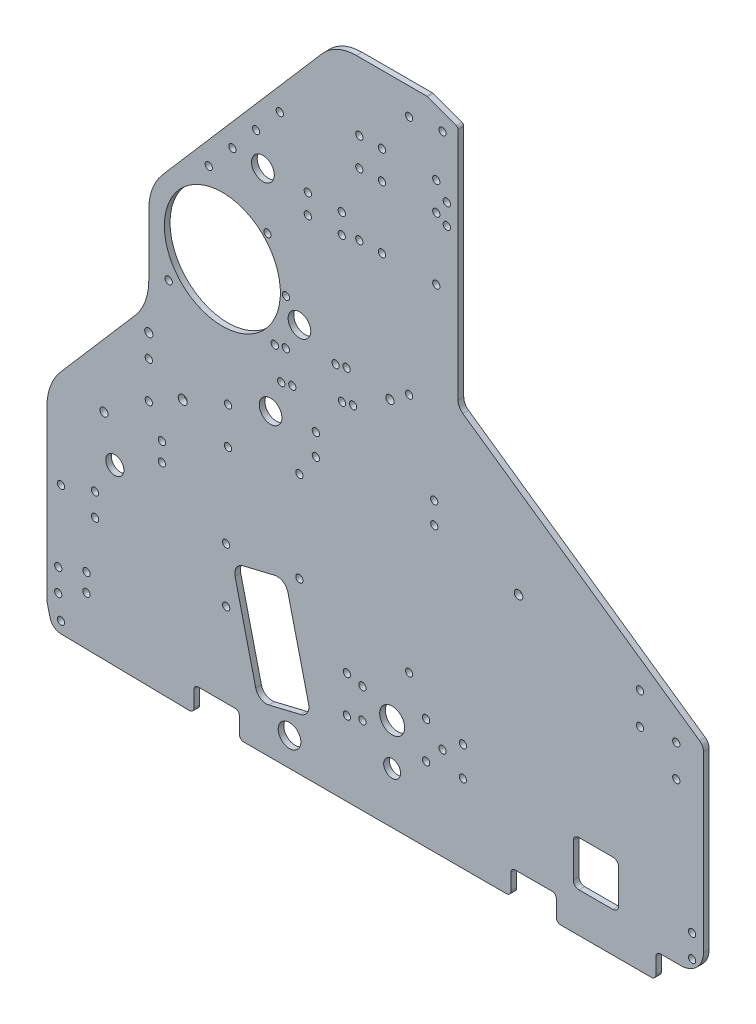
from build123d import *

# Parameters (mm, degrees)
SKETCH1_R           = 2.032
SKETCH1_R_2         = 5.08
SKETCH1_R_3         = 2.54
SKETCH1_R_4         = 6.35
SKETCH1_R_5         = 2
BOSS_EXTRUDE1_DEPTH = 3.175
FILLET1_R           = 2.286
FILLET2_R           = 6.35
SKETCH2_R           = 2.032
CUT_EXTRUDE1_DEPTH  = 505.524983177
FILLET3_R           = 1.5875
SKETCH3_R           = 6.35
SKETCH3_R_2         = 2.032
SKETCH3_R_3         = 2.286
CUT_EXTRUDE2_DEPTH  = 505.524983177
SKETCH4_R           = 2.032
SKETCH4_R_2         = 6.985
SKETCH4_R_3         = 4.7625
CUT_EXTRUDE3_DEPTH  = 505.524983177
SKETCH5_W           = 29.448186139
SKETCH5_H           = 14.946422423
SKETCH5_R           = 32.54375
SKETCH5_R_2         = 6.35
SKETCH5_R_3         = 2.39
CUT_EXTRUDE5_DEPTH  = 505.524983177
FILLET4_R           = 31.75
CUT_EXTRUDE6_DEPTH  = 505.524983177
FILLET5_R           = 25.4
SKETCH8_R           = 2.032000002
SKETCH8_R_2         = 2.031999999
SKETCH8_R_3         = 2.031999998
CUT_EXTRUDE7_DEPTH  = 505.524983177
SKETCH10_R          = 2.031999996
CUT_EXTRUDE8_DEPTH  = 505.524983177
SKETCH11_RX         = 2.032
SKETCH11_RY         = 2.031999502
CUT_EXTRUDE9_DEPTH  = 505.524983177
SKETCH12_R          = 2.032
CUT_EXTRUDE10_DEPTH = 505.524983319
SKETCH14_R          = 6.375981846
CUT_EXTRUDE11_DEPTH = 505.524983319
SKETCH15_R          = 2.286
CUT_EXTRUDE12_DEPTH = 505.524983319
FILLET6_R           = 12.7
FILLET7_R           = 5.08
FILLET8_R           = 2.54


with BuildPart() as part:
    # Sketch1 → Boss-Extrude1 (new body)
    with BuildSketch(Plane.XY):
        with BuildLine():
            Line((7.829508682, -19.049081656), (82.55, -20.32))
            Line((82.55, -20.32), (82.55, -6.35))
            Line((82.55, -6.35), (107.95, -6.35))
            Line((107.95, -6.35), (107.95, -20.32))
            Line((107.95, -20.32), (260.35, -20.32))
            Line((260.35, -20.32), (260.35, -6.35))
            Line((260.35, -6.35), (285.75, -6.35))
            Line((285.75, -6.35), (285.75, -20.32))
            Line((285.75, -20.32), (368.3, -20.32))
            Line((368.3, -20.32), (368.3, 106.68))
            Line((368.3, 106.68), (230.66375, 202.565))
            Line((230.66375, 202.565), (230.66375, 338.455))
            Line((230.66375, 338.455), (213.19998, 344.805))
            Line((213.19998, 344.805), (203.2, 344.805))
            Line((203.2, 344.805), (161.925, 344.805))
            Line((161.925, 344.805), (52.720122664, 218.469945827))
            ThreePointArc((52.720122664, 218.469945827), (52.803835479, 218.142145922), (52.832, 217.805))
            ThreePointArc((52.832, 217.805), (52.095493096, 216.239521914), (50.419872403, 215.808871996))
            Line((50.419872403, 215.808871996), (0, 157.48))
            Line((0, 157.48), (0, 0))
            Line((0, 0), (0, -6.35))
            ThreePointArc((0, -6.35), (0.047577015, -7.125863724), (0.189595124, -7.890101219))
            Line((0.189595124, -7.890101219), (1.777095124, -14.240101219))
            ThreePointArc((1.777095124, -14.240101219), (3.987212552, -17.671692778), (7.829508682, -19.049081656))
        make_face()
        with Locations((7.9375, -12.7)):
            Circle(SKETCH1_R, mode=Mode.SUBTRACT)
        with Locations((6.35, 0)):
            Circle(SKETCH1_R, mode=Mode.SUBTRACT)
        with Locations((6.35, 12.7)):
            Circle(SKETCH1_R, mode=Mode.SUBTRACT)
        with Locations((38.1, 78.105)):
            Circle(SKETCH1_R_2, mode=Mode.SUBTRACT)
        with Locations((57.15, 118.58625)):
            Circle(SKETCH1_R, mode=Mode.SUBTRACT)
        with Locations((57.15, 139.22375)):
            Circle(SKETCH1_R, mode=Mode.SUBTRACT)
        with Locations((76.2, 128.905)):
            Circle(SKETCH1_R_3, mode=Mode.SUBTRACT)
        with Locations((101.6, 118.58625)):
            Circle(SKETCH1_R, mode=Mode.SUBTRACT)
        with Locations((101.6, 139.22375)):
            Circle(SKETCH1_R, mode=Mode.SUBTRACT)
        with Locations((125.468192568, 147.91106164)):
            Circle(SKETCH1_R_4, mode=Mode.SUBTRACT)
        with Locations((203.2, 59.805)):
            Circle(SKETCH1_R_5, mode=Mode.SUBTRACT)
        with Locations((361.95, 0)):
            Circle(SKETCH1_R, mode=Mode.SUBTRACT)
        with Locations((361.95, 12.7)):
            Circle(SKETCH1_R, mode=Mode.SUBTRACT)
        with Locations((353.06, 82.955052336)):
            Circle(SKETCH1_R, mode=Mode.SUBTRACT)
        with Locations((332.74, 98.195052336)):
            Circle(SKETCH1_R, mode=Mode.SUBTRACT)
        with Locations((332.74, 115.975052336)):
            Circle(SKETCH1_R, mode=Mode.SUBTRACT)
        with Locations((353.06, 100.735052336)):
            Circle(SKETCH1_R, mode=Mode.SUBTRACT)
        with Locations((68.326, 182.923674932)):
            Circle(SKETCH1_R, mode=Mode.SUBTRACT)
        with Locations((76.2, 217.805)):
            Circle(SKETCH1_R, mode=Mode.SUBTRACT)
        with Locations((90.779500502, 249.682)):
            Circle(SKETCH1_R, mode=Mode.SUBTRACT)
        with Locations((104.067838673, 265.054783374)):
            Circle(SKETCH1_R, mode=Mode.SUBTRACT)
        with Locations((117.356176844, 280.427566748)):
            Circle(SKETCH1_R, mode=Mode.SUBTRACT)
        with Locations((130.644515014, 295.800350122)):
            Circle(SKETCH1_R, mode=Mode.SUBTRACT)
        with Locations((203.2, 194.805)):
            Circle(SKETCH1_R_5, mode=Mode.SUBTRACT)
        with Locations((224.31375, 287.401)):
            Circle(SKETCH1_R, mode=Mode.SUBTRACT)
        with Locations((224.31375, 298.831)):
            Circle(SKETCH1_R, mode=Mode.SUBTRACT)
        with Locations((203.2, 329.805)):
            Circle(SKETCH1_R_5, mode=Mode.SUBTRACT)
        with Locations((221.931865, 332.105)):
            Circle(SKETCH1_R_5, mode=Mode.SUBTRACT)
    extrude(amount=BOSS_EXTRUDE1_DEPTH)

    # Fillet1
    fillet1_edges = [part.edges().sort_by_distance(p)[0] for p in [
        (285.75, -6.35, 1.5875),
        (107.95, -6.35, 1.5875),
        (260.35, -6.35, 1.5875),
        (82.55, -6.35, 1.5875),
    ]]
    fillet(fillet1_edges, radius=FILLET1_R)

    # Fillet2
    fillet2_edges = [part.edges().sort_by_distance(p)[0] for p in [
        (230.66375, 202.565, 1.5875),
    ]]
    fillet(fillet2_edges, radius=FILLET2_R)

    # Sketch2 → Cut-Extrude1 (cut, through all)
    with BuildSketch(Plane(origin=(0, 0, 0), x_dir=(-1, 0, 0), z_dir=(0, 0, -1))):
        with Locations((-100.552770272, 71.086035298)):
            Circle(SKETCH2_R)
        with Locations((-100.552770272, 40.606035298)):
            Circle(SKETCH2_R)
        with Locations((-22.225, 18.202541089)):
            Circle(SKETCH2_R)
        with Locations((-22.225, 8.042541089)):
            Circle(SKETCH2_R)
    extrude(amount=-CUT_EXTRUDE1_DEPTH, mode=Mode.SUBTRACT)

    # Fillet3
    fillet3_edges = [part.edges().sort_by_distance(p)[0] for p in [
        (230.66375, 338.455, 1.5875),
        (213.19998, 344.805, 1.5875),
    ]]
    fillet(fillet3_edges, radius=FILLET3_R)

    # Sketch3 → Cut-Extrude2 (cut, through all)
    with BuildSketch(Plane.XY.offset(3.175)):
        with BuildLine():
            Line((127.789350211, 69.359774106), (110.090750339, 65.117184968))
            ThreePointArc((110.090750339, 65.117184968), (106.287939856, 62.356288953), (105.55119507, 57.715047577))
            Line((105.55119507, 57.715047577), (117.160037875, 9.287010566))
            ThreePointArc((117.160037875, 9.287010566), (119.92093389, 5.484200083), (124.562175266, 4.747455297))
            Line((124.562175266, 4.747455297), (142.260775137, 8.990044434))
            ThreePointArc((142.260775137, 8.990044434), (146.063585621, 11.75094045), (146.800330407, 16.392181825))
            Line((146.800330407, 16.392181825), (135.191487602, 64.820218836))
            ThreePointArc((135.191487602, 64.820218836), (132.430591586, 68.62302932), (127.789350211, 69.359774106))
        make_face()
        with Locations((136.094563167, -4.324155877)):
            Circle(SKETCH3_R)
        with Locations((26.987500002, 46.953113935)):
            Circle(SKETCH3_R_2)
        with Locations((26.987500002, 59.653113935)):
            Circle(SKETCH3_R_2)
        with Locations((7.937500002, 53.303113935)):
            Circle(SKETCH3_R_2)
        with Locations((32.030600738, 100.810868776)):
            Circle(SKETCH3_R_3)
        with Locations((64.525942114, 102.94048958)):
            Circle(SKETCH3_R_2)
        with Locations((64.525942114, 92.525786339)):
            Circle(SKETCH3_R_2)
        with Locations((134.14375, 208.228121768)):
            Circle(SKETCH3_R_2)
        with Locations((123.681970341, 233.485092108)):
            Circle(SKETCH3_R_2)
    extrude(amount=-CUT_EXTRUDE2_DEPTH, mode=Mode.SUBTRACT)

    # Sketch4 → Cut-Extrude3 (cut, through all)
    with BuildSketch(Plane.XY.offset(3.175)):
        with Locations((168.275, 42.06875)):
            Circle(SKETCH4_R)
        with Locations((212.725, 42.06875)):
            Circle(SKETCH4_R)
        with Locations((212.725, 21.43125)):
            Circle(SKETCH4_R)
        with Locations((168.275, 21.43125)):
            Circle(SKETCH4_R)
        with Locations((193.675, 31.75)):
            Circle(SKETCH4_R_2)
        with Locations((177.00498, 40.0431)):
            Circle(SKETCH4_R)
        with Locations((177.00498, 23.4569)):
            Circle(SKETCH4_R)
        with Locations((193.675, 8.466666658)):
            Circle(SKETCH4_R_3)
        with Locations((221.931865, 31.75)):
            Circle(SKETCH4_R)
        with Locations((233.36123, 23.4569)):
            Circle(SKETCH4_R)
        with Locations((233.36123, 40.0431)):
            Circle(SKETCH4_R)
    extrude(amount=-CUT_EXTRUDE3_DEPTH, mode=Mode.SUBTRACT)

    # Sketch5 → Cut-Extrude5 (cut, through all)
    with BuildSketch(Plane(origin=(0, 0, 0), x_dir=(-1, 0, 0), z_dir=(0, 0, -1))):
        Polygon((0, 157.48), (-57.15, 223.594705882), (-57.15, 165.333696112), (0, 99.218990229), align=None)
        with Locations((-356.354093068, -13.823211213)):
            Rectangle(SKETCH5_W, SKETCH5_H)
        with Locations((-98.425, 208.228121768)):
            Circle(SKETCH5_R)
        with Locations((-141.675587431, 197.971943782)):
            Circle(SKETCH5_R_2)
        with Locations((-264.573581764, 128.332790468)):
            Circle(SKETCH5_R_3)
    extrude(amount=-CUT_EXTRUDE5_DEPTH, mode=Mode.SUBTRACT)

    # Fillet4
    fillet4_edges = [part.edges().sort_by_distance(p)[0] for p in [
        (0, 99.218990229, 1.5875),
        (57.15, 165.333696112, 1.5875),
        (57.15, 223.594705882, 1.5875),
    ]]
    fillet(fillet4_edges, radius=FILLET4_R)

    # Sketch6 → Cut-Extrude6 (cut, through all)
    with BuildSketch(Plane.XY.offset(3.175)):
        with BuildLine():
            Line((298.45, 27.305), (317.5, 27.305))
            ThreePointArc((317.5, 27.305), (319.74506403, 26.37506403), (320.675, 24.13))
            Line((320.675, 24.13), (320.675, 5.08))
            ThreePointArc((320.675, 5.08), (319.74506403, 2.83493597), (317.5, 1.905))
            Line((317.5, 1.905), (298.45, 1.905))
            ThreePointArc((298.45, 1.905), (296.20493597, 2.83493597), (295.275, 5.08))
            Line((295.275, 5.08), (295.275, 24.13))
            ThreePointArc((295.275, 24.13), (296.20493597, 26.37506403), (298.45, 27.305))
        make_face()
    extrude(amount=-CUT_EXTRUDE6_DEPTH, mode=Mode.SUBTRACT)

    # Fillet5
    fillet5_edges = [part.edges().sort_by_distance(p)[0] for p in [
        (161.925, 344.805, 1.5875),
    ]]
    fillet(fillet5_edges, radius=FILLET5_R)

    # Sketch8 → Cut-Extrude7 (cut, through all)
    with BuildSketch(Plane(origin=(0, 0, 0), x_dir=(-1, 0, 0), z_dir=(0, 0, -1))):
        with Locations((-218.44, 290.83)):
            Circle(SKETCH8_R)
        with Locations((-187.96, 290.83)):
            Circle(SKETCH8_R)
        with Locations((-187.96, 306.70500001)):
            Circle(SKETCH8_R_2)
        with Locations((-175.26, 290.83)):
            Circle(SKETCH8_R)
        with Locations((-187.96, 255.905)):
            Circle(SKETCH8_R)
        with Locations((-218.44, 306.70500001)):
            Circle(SKETCH8_R_3)
        with Locations((-175.26, 306.70500001)):
            Circle(SKETCH8_R_2)
        with Locations((-175.26, 255.905)):
            Circle(SKETCH8_R)
        with Locations((-218.44, 255.905)):
            Circle(SKETCH8_R)
    extrude(amount=-CUT_EXTRUDE7_DEPTH, mode=Mode.SUBTRACT)

    # Sketch10 → Cut-Extrude8 (cut, through all)
    with BuildSketch(Plane.XY.offset(3.175)):
        with Locations((141.642480004, 74.684371768)):
            Circle(SKETCH10_R)
        with Locations((141.642480004, 125.484371768)):
            Circle(SKETCH10_R)
    extrude(amount=-CUT_EXTRUDE8_DEPTH, mode=Mode.SUBTRACT)

    # Sketch11 → Cut-Extrude9 (cut, through all)
    with BuildSketch(Plane.XY.offset(3.175)):
        with Locations(Location((150.881424454, 138.43), (0, 0, 90))):
            Ellipse(SKETCH11_RX, SKETCH11_RY)
        with Locations(Location((150.881424454, 150.495), (0, 0, 90))):
            Ellipse(SKETCH11_RX, SKETCH11_RY)
        with Locations(Location((217.30240818, 150.495), (0, 0, 90))):
            Ellipse(SKETCH11_RX, SKETCH11_RY)
        with Locations(Location((217.30240818, 138.43), (0, 0, 90))):
            Ellipse(SKETCH11_RX, SKETCH11_RY)
    extrude(amount=-CUT_EXTRUDE9_DEPTH, mode=Mode.SUBTRACT)

    # Sketch12 → Cut-Extrude10 (cut, through all)
    with BuildSketch(Plane(origin=(0, 0, 0), x_dir=(-1, 0, 0), z_dir=(0, 0, -1))):
        with Locations((-165.4175, 264.63498)):
            Circle(SKETCH12_R)
        with Locations((-165.4175, 253.52248)):
            Circle(SKETCH12_R)
        with Locations((-146.3675, 253.52248)):
            Circle(SKETCH12_R)
        with Locations((-146.3675, 264.63498)):
            Circle(SKETCH12_R)
    extrude(amount=-CUT_EXTRUDE10_DEPTH, mode=Mode.SUBTRACT)

    # Sketch14 → Cut-Extrude11 (cut, through all)
    with BuildSketch(Plane(origin=(0, 0, 0), x_dir=(-1, 0, 0), z_dir=(0, 0, -1))):
        with Locations((-121.184716432, 263.688494682)):
            Circle(SKETCH14_R)
    extrude(amount=-CUT_EXTRUDE11_DEPTH, mode=Mode.SUBTRACT)

    # Sketch15 → Cut-Extrude12 (cut, through all)
    with BuildSketch(Plane.XY.offset(3.175)):
        with Locations((57.15, 151.92375)):
            Circle(SKETCH15_R)
        with Locations((192.439038956, 187.119947783)):
            Circle(SKETCH15_R)
        with BuildLine():
            ThreePointArc((163.873739892, 173.680575348), (163.573171662, 172.102507308), (164.512499361, 170.799317578))
            ThreePointArc((164.512499361, 170.799317578), (167.540838635, 172.982117899), (163.873739892, 173.680575348))
        make_face()
        with BuildLine():
            ThreePointArc((173.43975005, 172.778441408), (173.74031828, 174.356509448), (172.800990581, 175.659699178))
            ThreePointArc((172.800990581, 175.659699178), (169.772651307, 173.476898857), (173.43975005, 172.778441408))
        make_face()
        with BuildLine():
            ThreePointArc((169.158852977, 192.088320238), (166.130513704, 189.905519916), (169.797612447, 189.207062467))
            ThreePointArc((169.797612447, 189.207062467), (170.098180676, 190.785130507), (169.158852977, 192.088320238))
        make_face()
        with BuildLine():
            ThreePointArc((160.231602288, 190.109196408), (159.931034058, 188.531128368), (160.870361758, 187.227938637))
            ThreePointArc((160.870361758, 187.227938637), (163.898701031, 189.410738959), (160.231602288, 190.109196408))
        make_face()
        with BuildLine():
            ThreePointArc((129.776601843, 166.121421831), (129.476033613, 164.543353791), (130.415361312, 163.240164061))
            ThreePointArc((130.415361312, 163.240164061), (133.443700586, 165.422964382), (129.776601843, 166.121421831))
        make_face()
        with BuildLine():
            ThreePointArc((139.342612002, 165.219287891), (139.643180231, 166.797355931), (138.703852532, 168.100545661))
            ThreePointArc((138.703852532, 168.100545661), (135.675513258, 165.91774534), (139.342612002, 165.219287891))
        make_face()
        with BuildLine():
            ThreePointArc((135.700474398, 181.647908951), (136.001042628, 183.225976991), (135.061714929, 184.529166721))
            ThreePointArc((135.061714929, 184.529166721), (132.033375655, 182.3463664), (135.700474398, 181.647908951))
        make_face()
        with BuildLine():
            ThreePointArc((126.134464239, 182.550042891), (125.83389601, 180.971974851), (126.773223709, 179.668785121))
            ThreePointArc((126.773223709, 179.668785121), (129.801562983, 181.851585442), (126.134464239, 182.550042891))
        make_face()
    extrude(amount=-CUT_EXTRUDE12_DEPTH, mode=Mode.SUBTRACT)

    # Fillet6
    fillet6_edges = [part.edges().sort_by_distance(p)[0] for p in [
        (368.3, -6.350000001, 1.5875),
    ]]
    fillet(fillet6_edges, radius=FILLET6_R)

    # Fillet7
    fillet7_edges = [part.edges().sort_by_distance(p)[0] for p in [
        (368.3, 106.68, 1.5875),
    ]]
    fillet(fillet7_edges, radius=FILLET7_R)

    # Fillet8
    fillet8_edges = [part.edges().sort_by_distance(p)[0] for p in [
        (82.55, -20.32, 1.5875),
        (107.95, -20.32, 1.5875),
        (260.35, -20.32, 1.5875),
        (285.75, -20.32, 1.5875),
        (341.629999999, -20.32, 1.5875),
        (341.629999999, -6.350000001, 1.5875),
    ]]
    fillet(fillet8_edges, radius=FILLET8_R)


solid = part.part
